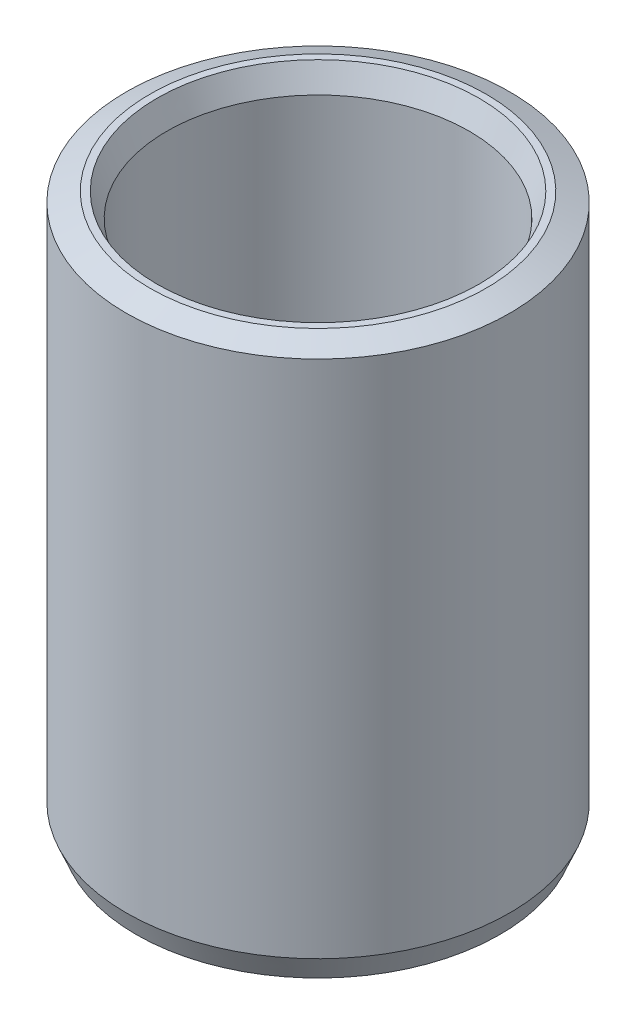
from build123d import *
from OCP.BRepFilletAPI import BRepFilletAPI_MakeChamfer

# Parameters (mm, degrees)
SKETCH1_R           = 47.5
BOSS_EXTRUDE1_DEPTH = 136.922978201
SKETCH2_R           = 37.463929541
CUT_EXTRUDE1_DEPTH  = 153.513612374
CHAMFER1_SIZE       = 2.431073926
CHAMFER1_SIZE2      = 5.856440364


with BuildPart() as part:
    # Sketch1 → Boss-Extrude1 (new body)
    with BuildSketch(Plane(origin=(0, 0, 0), x_dir=(1, 0, 0), z_dir=(0, 1, 0))):
        Circle(SKETCH1_R)
    extrude(amount=BOSS_EXTRUDE1_DEPTH)

    # Sketch2 → Cut-Extrude1 (cut, through all)
    with BuildSketch(Plane(origin=(0, 0, 0), x_dir=(1, 0, 0), z_dir=(0, 1, 0))):
        Circle(SKETCH2_R)
    extrude(amount=CUT_EXTRUDE1_DEPTH, mode=Mode.SUBTRACT)

    # Chamfer1: one chamfer whose edges measure the first distance from different faces: ONE call of the kernel's chamfer builder (chamfer() names one face for all edges)
    chamfer1_edges_1 = [part.edges().sort_by_distance(p)[0] for p in [
        (-37.463929541, 136.922978201, 0),
    ]]
    chamfer1_side_1 = [part.faces().sort_by_distance(p)[0] for p in [
        (-46.156497116, 136.922978201, 0),
    ]]
    chamfer1_edges_2 = [part.edges().sort_by_distance(p)[0] for p in [
        (-37.463929541, 0, 0),
    ]]
    chamfer1_side_2 = [part.faces().sort_by_distance(p)[0] for p in [
        (-37.463929541, 68.4614891, 0),
    ]]
    chamfer1_edges_3 = [part.edges().sort_by_distance(p)[0] for p in [
        (-47.5, 0, 0),
    ]]
    chamfer1_side_3 = [part.faces().sort_by_distance(p)[0] for p in [
        (-46.156497116, 0, 0),
    ]]
    chamfer1_edges_4 = [part.edges().sort_by_distance(p)[0] for p in [
        (-47.5, 136.922978201, 0),
    ]]
    chamfer1_side_4 = [part.faces().sort_by_distance(p)[0] for p in [
        (-47.5, 68.4614891, 0),
    ]]
    chamfer1 = BRepFilletAPI_MakeChamfer(part.part.solid().wrapped)
    for e in chamfer1_edges_1:
        chamfer1.Add(CHAMFER1_SIZE, CHAMFER1_SIZE2, e.wrapped, chamfer1_side_1[0].wrapped)  # the first distance lies on this face
    for e in chamfer1_edges_2:
        chamfer1.Add(CHAMFER1_SIZE, CHAMFER1_SIZE2, e.wrapped, chamfer1_side_2[0].wrapped)  # the first distance lies on this face
    for e in chamfer1_edges_3:
        chamfer1.Add(CHAMFER1_SIZE, CHAMFER1_SIZE2, e.wrapped, chamfer1_side_3[0].wrapped)  # the first distance lies on this face
    for e in chamfer1_edges_4:
        chamfer1.Add(CHAMFER1_SIZE, CHAMFER1_SIZE2, e.wrapped, chamfer1_side_4[0].wrapped)  # the first distance lies on this face
    add(Compound.cast(chamfer1.Shape()), mode=Mode.REPLACE)


solid = part.part
